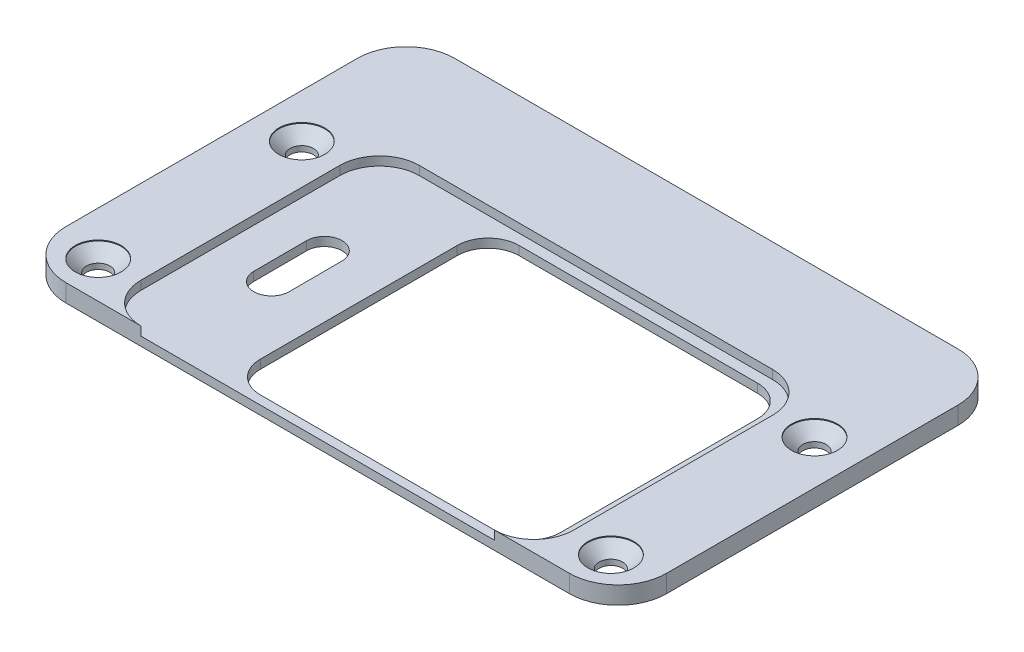
from build123d import *

# Parameters (mm, degrees)
SKETCH_1_W          = 68
SKETCH_1_H          = 44
EXTRUDE_1_DEPTH     = 2
FILLET_1_R          = 5.5
CUT_EXTRUDE_1_DEPTH = 1
CUT_EXTRUDE_2_DEPTH = 1
CUT_EXTRUDE_3_REACH = 65.352
SKETCH_5_R          = 1.325
CUT_EXTRUDE_5_DEPTH = 64.328343814
SKETCH_6_R          = 2.6
CUT_EXTRUDE_6_DEPTH = 1.5
CHAMFER_2_SIZE      = 1.4


with BuildPart() as part:
    # 草图1 → 凸台-拉伸1 (new body)
    with BuildSketch(Plane(origin=(0, 0, 0), x_dir=(1, 0, 0), z_dir=(0, 1, 0))):
        with Locations((23.975845411, -3.461352657)):
            Rectangle(SKETCH_1_W, SKETCH_1_H)
    extrude(amount=EXTRUDE_1_DEPTH)

    # 圆角1
    fillet_1_edges = [part.edges().sort_by_distance(p)[0] for p in [
        (-10.024154589, 1, -18.538647343),
        (57.975845411, 1, -18.538647343),
        (57.975845411, 1, 25.461352657),
        (-10.024154589, 1, 25.461352657),
    ]]
    fillet(fillet_1_edges, radius=FILLET_1_R)

    # 草图3 → 切除-拉伸1 (cut)
    with BuildSketch(Plane(origin=(0, 2, 0), x_dir=(1, 0, 0), z_dir=(0, 1, 0))):
        with BuildLine():
            Line((3.975845411, 6.038647343), (43.975845411, 6.038647343))
            ThreePointArc((43.975845411, 6.038647343), (47.157825926, 4.720627858), (48.475845411, 1.538647343))
            Line((48.475845411, 1.538647343), (48.475845411, -20.961352657))
            ThreePointArc((48.475845411, -20.961352657), (47.157825926, -24.143333172), (43.975845411, -25.461352657))
            Line((43.975845411, -25.461352657), (3.975845411, -25.461352657))
            ThreePointArc((3.975845411, -25.461352657), (0.793864895, -24.143333172), (-0.524154589, -20.961352657))
            Line((-0.524154589, -20.961352657), (-0.524154589, 1.538647343))
            ThreePointArc((-0.524154589, 1.538647343), (0.793864895, 4.720627858), (3.975845411, 6.038647343))
        make_face()
    extrude(amount=-CUT_EXTRUDE_1_DEPTH, mode=Mode.SUBTRACT)

    # 草图4 → 切除-拉伸2 (cut)
    with BuildSketch(Plane(origin=(0, 1, 0), x_dir=(1, 0, 0), z_dir=(0, 1, 0))):
        with BuildLine():
            Line((43.475845411, -24.461352657), (16.475845411, -24.461352657))
            ThreePointArc((16.475845411, -24.461352657), (14.000971676, -23.436226391), (12.975845411, -20.961352657))
            Line((12.975845411, -20.961352657), (12.975845411, 1.338647343))
            ThreePointArc((12.975845411, 1.338647343), (14.000971676, 3.813521077), (16.475845411, 4.838647343))
            Line((16.475845411, 4.838647343), (43.475845411, 4.838647343))
            ThreePointArc((43.475845411, 4.838647343), (45.950719145, 3.813521077), (46.975845411, 1.338647343))
            Line((46.975845411, 1.338647343), (46.975845411, -20.961352657))
            ThreePointArc((46.975845411, -20.961352657), (45.950719145, -23.436226391), (43.475845411, -24.461352657))
        make_face()
    extrude(amount=-CUT_EXTRUDE_2_DEPTH, mode=Mode.SUBTRACT)

    # 草图5 → 切除-拉伸3 (cut, up to next)
    with BuildSketch(Plane(origin=(0, 2, 0), x_dir=(1, 0, 0), z_dir=(0, 1, 0)), mode=Mode.PRIVATE) as cut_extrude_3_sk1:
        with Locations(Location((53.000845411, -21.286352657, 0), (0, 0, 270))):
            Circle(SKETCH_5_R)
    cut_extrude_3_tool1 = extrude(cut_extrude_3_sk1.sketch, amount=-CUT_EXTRUDE_3_REACH, mode=Mode.PRIVATE) & part.part
    # 草图5 → 切除-拉伸3 (cut, up to next)
    with BuildSketch(Plane(origin=(0, 2, 0), x_dir=(1, 0, 0), z_dir=(0, 1, 0)), mode=Mode.PRIVATE) as cut_extrude_3_sk2:
        with Locations(Location((53.000845411, 1.763647343, 0), (0, 0, 270))):
            Circle(SKETCH_5_R)
    cut_extrude_3_tool2 = extrude(cut_extrude_3_sk2.sketch, amount=-CUT_EXTRUDE_3_REACH, mode=Mode.PRIVATE) & part.part
    # 草图5 → 切除-拉伸3 (cut, up to next)
    with BuildSketch(Plane(origin=(0, 2, 0), x_dir=(1, 0, 0), z_dir=(0, 1, 0)), mode=Mode.PRIVATE) as cut_extrude_3_sk3:
        with Locations(Location((-5.049154589, 1.763647343, 0), (0, 0, 270))):
            Circle(SKETCH_5_R)
    cut_extrude_3_tool3 = extrude(cut_extrude_3_sk3.sketch, amount=-CUT_EXTRUDE_3_REACH, mode=Mode.PRIVATE) & part.part
    # 草图5 → 切除-拉伸3 (cut, up to next)
    with BuildSketch(Plane(origin=(0, 2, 0), x_dir=(1, 0, 0), z_dir=(0, 1, 0)), mode=Mode.PRIVATE) as cut_extrude_3_sk4:
        with Locations(Location((-5.049154589, -21.286352657, 0), (0, 0, 270))):
            Circle(SKETCH_5_R)
    cut_extrude_3_tool4 = extrude(cut_extrude_3_sk4.sketch, amount=-CUT_EXTRUDE_3_REACH, mode=Mode.PRIVATE) & part.part
    add(cut_extrude_3_tool1.solids().sort_by_distance((53.000845, 2, 21.286353))[0], mode=Mode.SUBTRACT)
    add(cut_extrude_3_tool2.solids().sort_by_distance((53.000845, 2, -1.763647))[0], mode=Mode.SUBTRACT)
    add(cut_extrude_3_tool3.solids().sort_by_distance((-5.049155, 2, -1.763647))[0], mode=Mode.SUBTRACT)
    add(cut_extrude_3_tool4.solids().sort_by_distance((-5.049155, 2, 21.286353))[0], mode=Mode.SUBTRACT)

    # 草图7 → 切除-拉伸5 (cut, through all)
    with BuildSketch(Plane(origin=(0, 1, 0), x_dir=(1, 0, 0), z_dir=(0, 1, 0))):
        with BuildLine():
            Line((7.975835944, -6.705199166), (7.994321526, -12.713332009))
            ThreePointArc((7.994321526, -12.713332009), (6.000484483, -14.719476033), (3.994340459, -12.72563899))
            Line((3.994340459, -12.72563899), (3.975854877, -6.717506148))
            ThreePointArc((3.975854877, -6.717506148), (5.96969192, -4.711362123), (7.975835944, -6.705199166))
        make_face()
    extrude(amount=-CUT_EXTRUDE_5_DEPTH, mode=Mode.SUBTRACT)

    # 草图6 → 切除-拉伸6 (cut)
    with BuildSketch(Plane(origin=(0, 2, 0), x_dir=(1, 0, 0), z_dir=(0, 1, 0))):
        with Locations(Location((-5.049154589, 1.763647343, 0), (0, 0, 270))):
            Circle(SKETCH_6_R)
        with Locations(Location((-5.049154589, -21.286352657, 0), (0, 0, 270))):
            Circle(SKETCH_6_R)
        with Locations(Location((53.000845411, 1.763647343, 0), (0, 0, 270))):
            Circle(SKETCH_6_R)
        with Locations(Location((53.000845411, -21.286352657, 0), (0, 0, 270))):
            Circle(SKETCH_6_R)
    extrude(amount=-CUT_EXTRUDE_6_DEPTH, mode=Mode.SUBTRACT)

    # 倒角2
    # the kernel refuses this chamfer: 1.4 mm, written as the material it adds along each edge
    with BuildSketch(Plane(origin=(53.000845411, 0.5, 21.286352657), x_dir=(0, 0, 1), z_dir=(-1, 0, 0))) as chamfer_2_piece_1_section:
        Polygon((2.6, CHAMFER_2_SIZE), (2.6 - CHAMFER_2_SIZE, 0), (2.6, 0), align=None)
    chamfer_2_piece_1 = revolve(axis=Axis((53.000845411, 0.5, 21.286352657), (0, 1, 0)), mode=Mode.PRIVATE)
    chamfer_2_piece_1 = chamfer_2_piece_1 - Plane(origin=(53.000845411, 1.265114472, 21.286352657), x_dir=(0, 0, 1), z_dir=(0, 1, 0)) * Cylinder(1.325, 11, mode=Mode.PRIVATE)
    add(chamfer_2_piece_1)
    with BuildSketch(Plane(origin=(-5.049154589, 0.5, 21.286352657), x_dir=(0, 0, 1), z_dir=(-1, 0, 0))) as chamfer_2_piece_2_section:
        Polygon((2.6, CHAMFER_2_SIZE), (2.6 - CHAMFER_2_SIZE, 0), (2.6, 0), align=None)
    chamfer_2_piece_2 = revolve(axis=Axis((-5.049154589, 0.5, 21.286352657), (0, 1, 0)), mode=Mode.PRIVATE)
    chamfer_2_piece_2 = chamfer_2_piece_2 - Plane(origin=(-5.049154589, 1.265114472, 21.286352657), x_dir=(0, 0, 1), z_dir=(0, 1, 0)) * Cylinder(1.325, 11, mode=Mode.PRIVATE)
    add(chamfer_2_piece_2)
    with BuildSketch(Plane(origin=(-5.049154589, 0.5, -1.763647343), x_dir=(0, 0, 1), z_dir=(-1, 0, 0))) as chamfer_2_piece_3_section:
        Polygon((2.6, CHAMFER_2_SIZE), (2.6 - CHAMFER_2_SIZE, 0), (2.6, 0), align=None)
    chamfer_2_piece_3 = revolve(axis=Axis((-5.049154589, 0.5, -1.763647343), (0, 1, 0)), mode=Mode.PRIVATE)
    chamfer_2_piece_3 = chamfer_2_piece_3 - Plane(origin=(-5.049154589, 1.265114472, -1.763647343), x_dir=(0, 0, 1), z_dir=(0, 1, 0)) * Cylinder(1.325, 11, mode=Mode.PRIVATE)
    add(chamfer_2_piece_3)
    with BuildSketch(Plane(origin=(53.000845411, 0.5, -1.763647343), x_dir=(0, 0, 1), z_dir=(-1, 0, 0))) as chamfer_2_piece_4_section:
        Polygon((2.6, CHAMFER_2_SIZE), (2.6 - CHAMFER_2_SIZE, 0), (2.6, 0), align=None)
    chamfer_2_piece_4 = revolve(axis=Axis((53.000845411, 0.5, -1.763647343), (0, 1, 0)), mode=Mode.PRIVATE)
    chamfer_2_piece_4 = chamfer_2_piece_4 - Plane(origin=(53.000845411, 1.265114472, -1.763647343), x_dir=(0, 0, 1), z_dir=(0, 1, 0)) * Cylinder(1.325, 11, mode=Mode.PRIVATE)
    add(chamfer_2_piece_4)


solid = part.part
